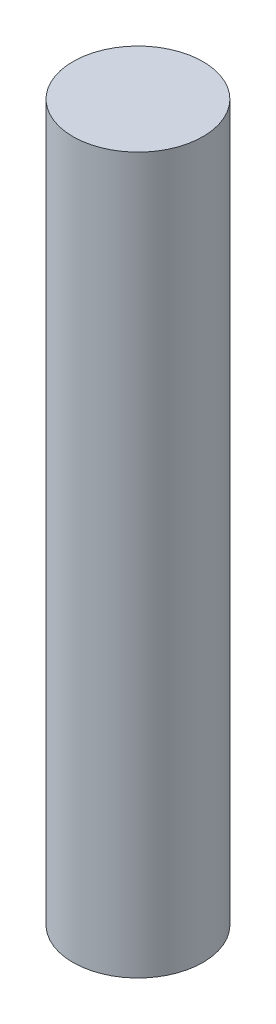
from build123d import *

# Parameters (mm, degrees)
SKETCH1_R           = 1.5
BOSS_EXTRUDE1_DEPTH = 16.5


with BuildPart() as part:
    # Sketch1 → Boss-Extrude1 (new body)
    with BuildSketch(Plane(origin=(0, 0, 0), x_dir=(1, 0, 0), z_dir=(0, 1, 0))):
        Circle(SKETCH1_R)
    extrude(amount=BOSS_EXTRUDE1_DEPTH)


solid = part.part
